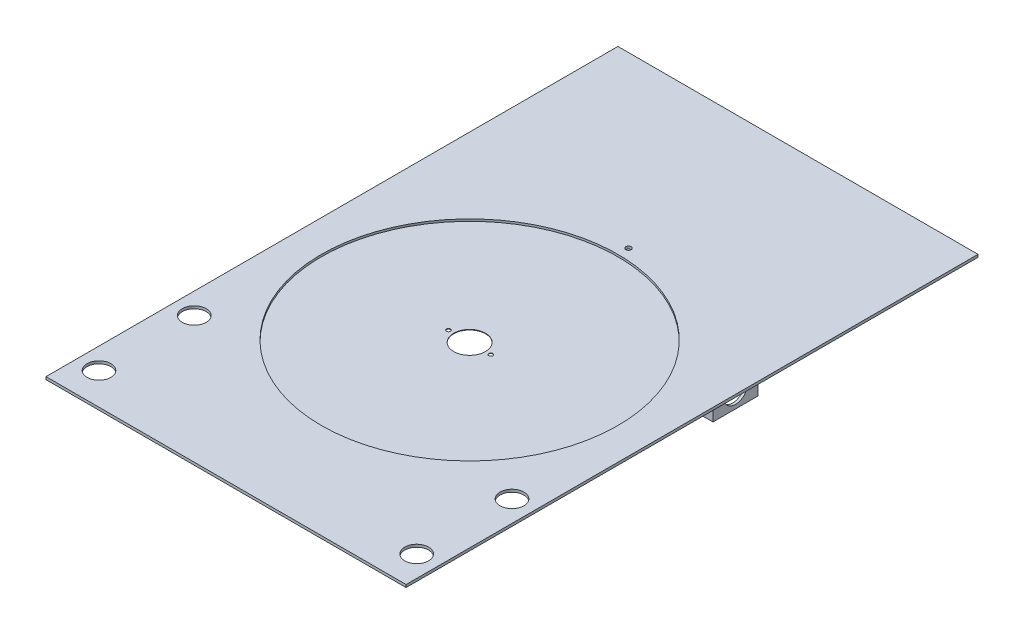
from build123d import *

# Parameters (mm, degrees)
SKETCH1_W           = 431.8
SKETCH1_H           = 685.8
BOSS_EXTRUDE1_DEPTH = 3.175
SKETCH2_R           = 14.2875
CUT_EXTRUDE1_DEPTH  = 406.22006444
SKETCH3_W           = 54.61
SKETCH3_H           = 53.975
BOSS_EXTRUDE2_DEPTH = 203.2
FILLET1_R           = 20.32
SKETCH4_W           = 48.26
SKETCH4_H           = 47.625
CUT_EXTRUDE2_DEPTH  = 203.2
SKETCH5_R           = 14.2875
CUT_EXTRUDE3_DEPTH  = 203.2
SKETCH6_R           = 177.8
CUT_EXTRUDE4_DEPTH  = 2.54
SKETCH7_R           = 2.38125
SKETCH7_R_2         = 19.05
CUT_EXTRUDE5_DEPTH  = 454.587838489
SKETCH8_R           = 3.175
CUT_EXTRUDE6_DEPTH  = 455.734934467


with BuildPart() as part:
    # Sketch1 → Boss-Extrude1 (new body)
    with BuildSketch(Plane(origin=(0, 0, 0), x_dir=(1, 0, 0), z_dir=(0, 1, 0))):
        Rectangle(SKETCH1_W, SKETCH1_H)
    extrude(amount=BOSS_EXTRUDE1_DEPTH)

    # Sketch2 → Cut-Extrude1 (cut, through all)
    with BuildSketch(Plane(origin=(0, 3.175, 0), x_dir=(1, 0, 0), z_dir=(0, 1, 0))):
        with Locations((-190.5, -304.8)):
            Circle(SKETCH2_R)
        with Locations((-190.5, -190.5)):
            Circle(SKETCH2_R)
        with Locations((190.5, -304.8)):
            Circle(SKETCH2_R)
        with Locations((190.5, -190.5)):
            Circle(SKETCH2_R)
    extrude(amount=-CUT_EXTRUDE1_DEPTH, mode=Mode.SUBTRACT)

    # Sketch3 → Boss-Extrude2 (add)
    with BuildSketch(Plane(origin=(0, 0, 0), x_dir=(-1, 0, 0), z_dir=(0, -1, 0))):
        with Locations((2.565647285, 243.220856884)):
            Rectangle(SKETCH3_W, SKETCH3_H)
    extrude(amount=BOSS_EXTRUDE2_DEPTH)

    # Fillet1
    fillet1_edges = [part.edges().sort_by_distance(p)[0] for p in [
        (24.739352715, 0, -243.220856884),
        (-2.565647285, 0, -270.208356884),
        (-2.565647285, 0, -216.233356884),
        (-29.870647285, 0, -243.220856884),
    ]]
    fillet(fillet1_edges, radius=FILLET1_R)

    # Sketch4 → Cut-Extrude2 (cut)
    with BuildSketch(Plane(origin=(0, -203.2, 0), x_dir=(-1, 0, 0), z_dir=(0, -1, 0))):
        with Locations((2.565647285, 243.220856884)):
            Rectangle(SKETCH4_W, SKETCH4_H)
    extrude(amount=-CUT_EXTRUDE2_DEPTH, mode=Mode.SUBTRACT)

    # Sketch5 → Cut-Extrude3 (cut)
    with BuildSketch(Plane.ZY.offset(29.870647285)):
        with Locations((-243.220856884, -184.15)):
            Circle(SKETCH5_R)
    extrude(amount=-CUT_EXTRUDE3_DEPTH, mode=Mode.SUBTRACT)

    # Sketch6 → Cut-Extrude4 (cut)
    with BuildSketch(Plane(origin=(0, 3.175, 0), x_dir=(1, 0, 0), z_dir=(0, 1, 0))):
        with Locations((0, -50.8)):
            Circle(SKETCH6_R)
    extrude(amount=-CUT_EXTRUDE4_DEPTH, mode=Mode.SUBTRACT)

    # Sketch7 → Cut-Extrude5 (cut, through all)
    with BuildSketch(Plane(origin=(0, 0.635, 0), x_dir=(1, 0, 0), z_dir=(0, 1, 0))):
        with Locations((25.4, -50.8)):
            Circle(SKETCH7_R)
        with Locations((-25.4, -50.8)):
            Circle(SKETCH7_R)
        with Locations((0, -50.8)):
            Circle(SKETCH7_R_2)
    extrude(amount=-CUT_EXTRUDE5_DEPTH, mode=Mode.SUBTRACT)

    # Sketch8 → Cut-Extrude6 (cut, through all)
    with BuildSketch(Plane(origin=(0, 3.175, 0), x_dir=(1, 0, 0), z_dir=(0, 1, 0))):
        with Locations((0, 139.7)):
            Circle(SKETCH8_R)
    extrude(amount=-CUT_EXTRUDE6_DEPTH, mode=Mode.SUBTRACT)


solid = part.part
